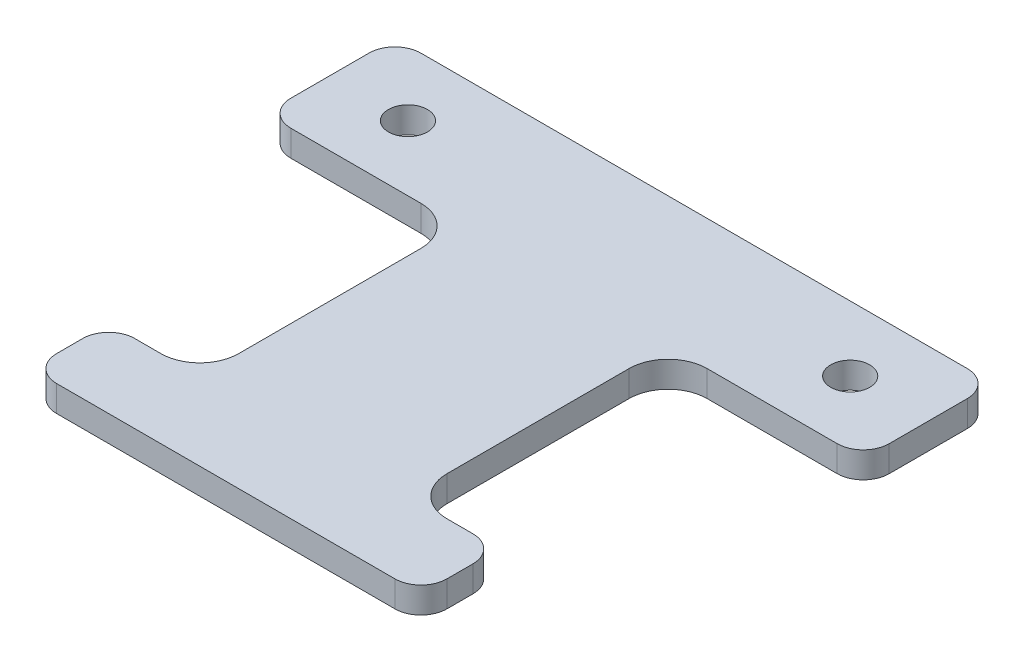
from build123d import *

# Parameters (mm, degrees)
AUFSATZ_LINEAR_AUSTRAGEN1_DEPTH  = 10
F_15_0_15_DURCHMESSER_BOHRUNG1_D = 15


with BuildPart() as part:
    # Skizze1 → Aufsatz-Linear austragen1 (new body)
    with BuildSketch(Plane(origin=(0, 0, 0), x_dir=(1, 0, 0), z_dir=(0, 1, 0))):
        with BuildLine():
            Line((-105, 90), (105, 90))
            ThreePointArc((105, 90), (112.071067812, 87.071067812), (115, 80))
            Line((115, 80), (115, 50))
            ThreePointArc((115, 50), (112.071067812, 42.928932188), (105, 40))
            Line((105, 40), (55, 40))
            ThreePointArc((55, 40), (44.393398282, 35.606601718), (40, 25))
            Line((40, 25), (40, -45))
            ThreePointArc((40, -45), (44.393398282, -55.606601718), (55, -60))
            Line((55, -60), (65, -60))
            ThreePointArc((65, -60), (72.071067812, -62.928932188), (75, -70))
            Line((75, -70), (75, -80))
            ThreePointArc((75, -80), (72.071067812, -87.071067812), (65, -90))
            Line((65, -90), (-65, -90))
            ThreePointArc((-65, -90), (-72.071067812, -87.071067812), (-75, -80))
            Line((-75, -80), (-75, -70))
            ThreePointArc((-75, -70), (-72.071067812, -62.928932188), (-65, -60))
            Line((-65, -60), (-55, -60))
            ThreePointArc((-55, -60), (-44.393398282, -55.606601718), (-40, -45))
            Line((-40, -45), (-40, 25))
            ThreePointArc((-40, 25), (-44.393398282, 35.606601718), (-55, 40))
            Line((-55, 40), (-105, 40))
            ThreePointArc((-105, 40), (-112.071067812, 42.928932188), (-115, 50))
            Line((-115, 50), (-115, 80))
            ThreePointArc((-115, 80), (-112.071067812, 87.071067812), (-105, 90))
        make_face()
    extrude(amount=AUFSATZ_LINEAR_AUSTRAGEN1_DEPTH)

    # Ø15.0 (15) Durchmesser Bohrung1 (through all)
    with Locations(Plane(origin=(0, 10, 0), x_dir=(1, 0, 0), z_dir=(0, 1, 0))):
        with Locations((-85, 65), (85, 65)):
            Hole(F_15_0_15_DURCHMESSER_BOHRUNG1_D / 2)


solid = part.part
